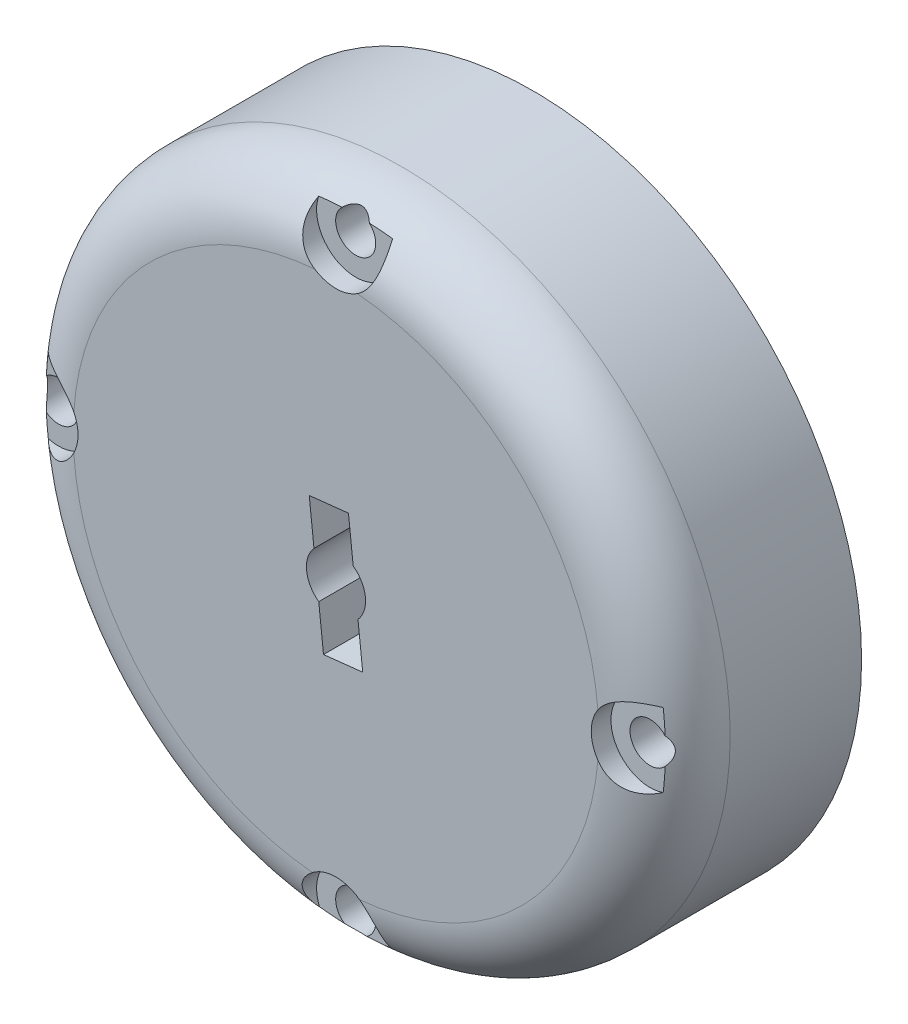
from build123d import *

# Parameters (mm, degrees)
SKETCH1_R                                           = 25
SKETCH1_R_2                                         = 19
BOSS_EXTRUDE1_DEPTH                                 = 5
SKETCH2_R                                           = 25
BOSS_EXTRUDE2_DEPTH                                 = 10
FILLET1_R                                           = 5
CBORE_FOR_3_BINDING_HEAD_MACHINE_SCREW1_D           = 3.048
CBORE_FOR_3_BINDING_HEAD_MACHINE_SCREW1_CBORE_D     = 5.95376
CBORE_FOR_3_BINDING_HEAD_MACHINE_SCREW1_CBORE_DEPTH = 1.4986
CUT_EXTRUDE1_START                                  = -3
CUT_EXTRUDE1_DEPTH                                  = 10


with BuildPart() as part:
    # Sketch1 → Boss-Extrude1 (new body)
    with BuildSketch(Plane.XY):
        Circle(SKETCH1_R)
        Circle(SKETCH1_R_2, mode=Mode.SUBTRACT)
    extrude(amount=BOSS_EXTRUDE1_DEPTH)

    # Sketch2 → Boss-Extrude2 (add)
    with BuildSketch(Plane.XY.offset(5)):
        Circle(SKETCH2_R)
    extrude(amount=BOSS_EXTRUDE2_DEPTH)

    # Fillet1
    fillet1_edges = [part.edges().sort_by_distance(p)[0] for p in [
        (-25, 0, 15),
        (-19, 0, 5),
    ]]
    fillet(fillet1_edges, radius=FILLET1_R - 0.0001)  # a hair under: the kernel refuses the full size

    # CBORE for #3 Binding Head Machine Screw1 (through all)
    with Locations(Plane.XY.offset(15)):
        with Locations((0, 22.435050854), (0, -22.295918756), (22.400267829, 0), (-22.608965977, 0)):
            CounterBoreHole(CBORE_FOR_3_BINDING_HEAD_MACHINE_SCREW1_D / 2, CBORE_FOR_3_BINDING_HEAD_MACHINE_SCREW1_CBORE_D / 2, CBORE_FOR_3_BINDING_HEAD_MACHINE_SCREW1_CBORE_DEPTH)

    # Sketch15 → Cut-Extrude1 (cut)
    with BuildSketch(Plane(origin=(0, 0, 5), x_dir=(-1, 0, 0), z_dir=(0, 0, -1)).offset(CUT_EXTRUDE1_START)):
        with BuildLine():
            Line((1.676226843, 1.500920907), (2.037127027, 4.807341739))
            Line((2.037127027, 4.807341739), (-0.948609283, 5.133238785))
            Line((-0.948609283, 5.133238785), (-1.309172026, 1.829909453))
            ThreePointArc((-1.309172026, 1.829909453), (-1.94216249, 1.136003901), (-2.236715327, 0.244140421))
            ThreePointArc((-2.236715327, 0.244140421), (-2.141502308, -0.690266516), (-1.673115077, -1.504388892))
            Line((-1.673115077, -1.504388892), (-2.03367782, -4.807718225))
            Line((-2.03367782, -4.807718225), (0.952058491, -5.133615271))
            Line((0.952058491, -5.133615271), (1.312958675, -1.827194439))
            ThreePointArc((1.312958675, -1.827194439), (1.943337692, -1.133992334), (2.236715327, -0.244140421))
            ThreePointArc((2.236715327, -0.244140421), (2.142215878, 0.688048787), (1.676226843, 1.500920907))
        make_face()
    extrude(amount=-CUT_EXTRUDE1_DEPTH, mode=Mode.SUBTRACT)


solid = part.part
